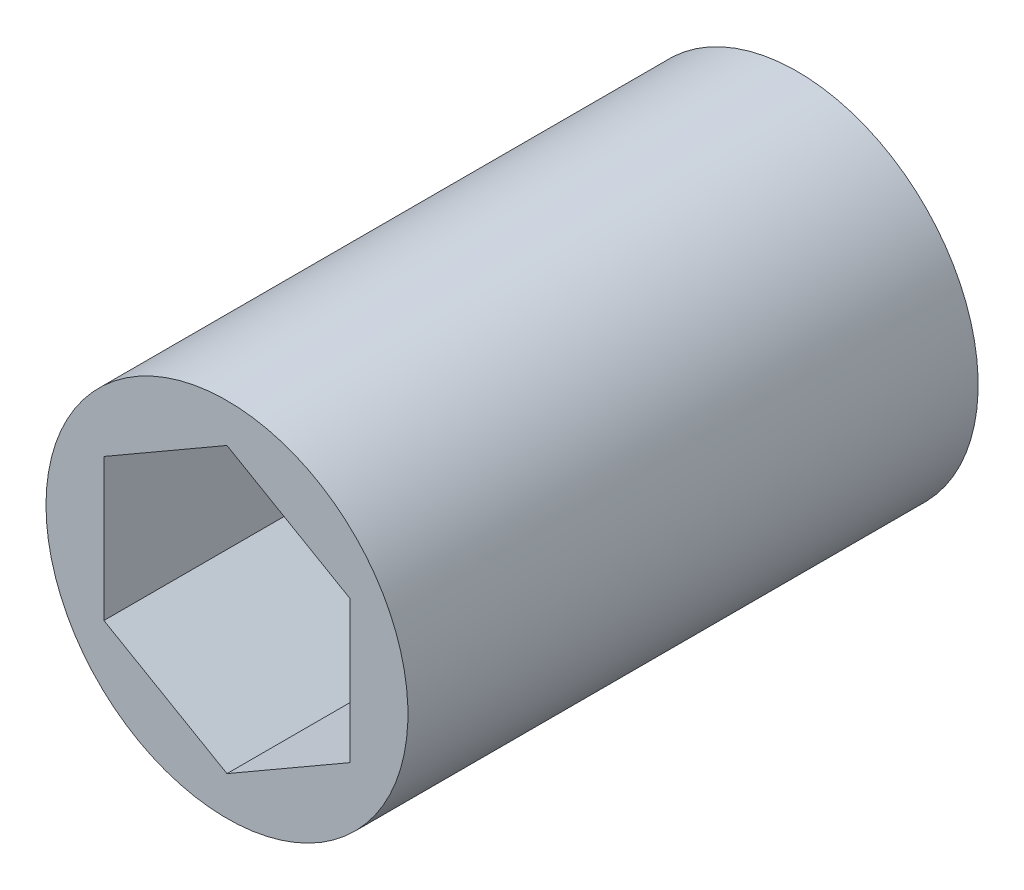
from build123d import *

# Parameters (mm, degrees)
SKETCH1_R           = 9.525
BOSS_EXTRUDE1_DEPTH = 30.01264


with BuildPart() as part:
    # Sketch1 → Boss-Extrude1 (new body)
    with BuildSketch(Plane.XY):
        Circle(SKETCH1_R)
        Polygon((0, 7.478995387), (-6.477, 3.739497694), (-6.477, -3.739497694), (0, -7.478995387), (6.477, -3.739497694), (6.477, 3.739497694), align=None, mode=Mode.SUBTRACT)
    extrude(amount=BOSS_EXTRUDE1_DEPTH)


solid = part.part
